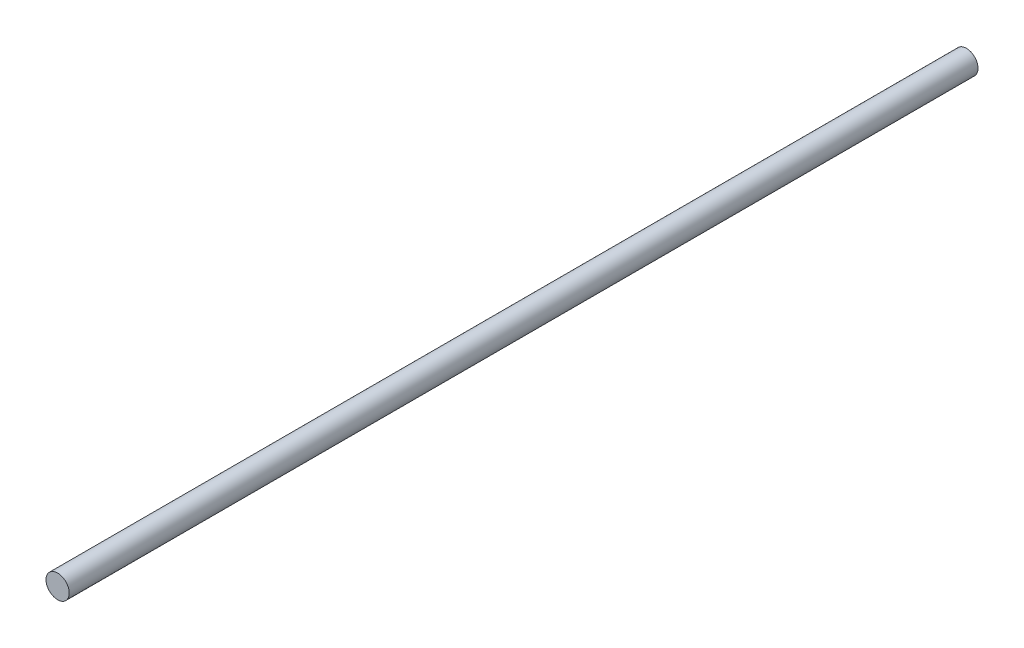
from build123d import *

# Parameters (mm, degrees)
SKETCH1_R           = 3
BOSS_EXTRUDE1_DEPTH = 235


with BuildPart() as part:
    # Sketch1 → Boss-Extrude1 (new body)
    with BuildSketch(Plane.XY):
        Circle(SKETCH1_R)
    extrude(amount=BOSS_EXTRUDE1_DEPTH)


solid = part.part
